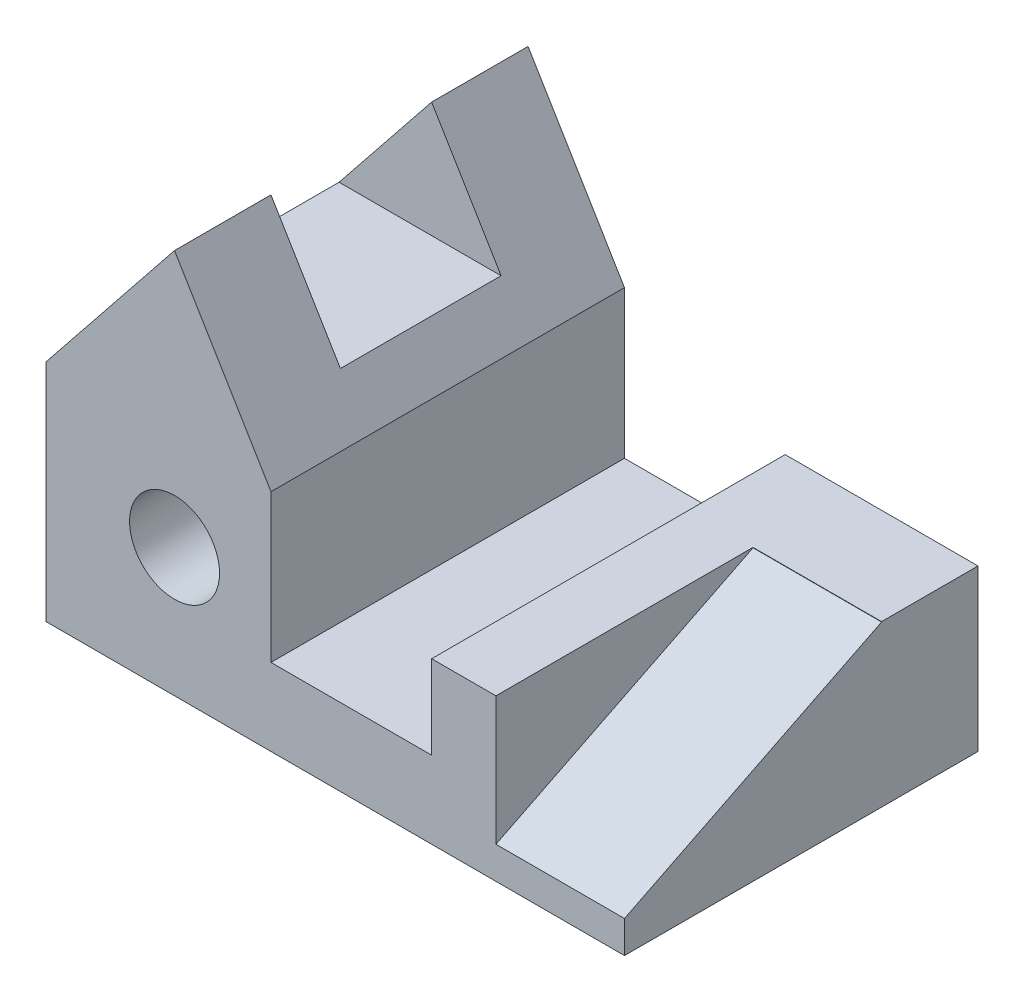
from build123d import *

# Parameters (mm, degrees)
SKETCH1_W             = 90
SKETCH1_H             = 55
BOSS_EXTRUDE1_DEPTH   = 5
SKETCH2_W             = 35
SKETCH2_H             = 55
BOSS_EXTRUDE2_DEPTH   = 30
F_1_0MM_DOWEL_HOLE1_D = 14
SKETCH5_W             = 10
SKETCH5_H             = 55
BOSS_EXTRUDE4_DEPTH   = 20
SKETCH8_W             = 20
SKETCH8_H             = 15
BOSS_EXTRUDE5_DEPTH   = 20
CHAMFER1_SIZE2        = 40
CHAMFER1_SIZE         = 19.943264322
SKETCH9_W             = 25
SKETCH9_H             = 55
BOSS_EXTRUDE6_DEPTH   = 7
BOSS_EXTRUDE7_DEPTH   = 55
SKETCH16_W            = 25
SKETCH16_H            = 18
BOSS_EXTRUDE8_DEPTH   = 43
SKETCH17_W            = 25
SKETCH17_H            = 18
CUT_EXTRUDE1_DEPTH    = 43
F_1_0MM_DOWEL_HOLE2_D = 14


with BuildPart() as part:
    # Sketch1 → Boss-Extrude1 (new body)
    with BuildSketch(Plane(origin=(0, 0, 0), x_dir=(1, 0, 0), z_dir=(0, 1, 0))):
        with Locations((45, -27.5)):
            Rectangle(SKETCH1_W, SKETCH1_H)
    extrude(amount=BOSS_EXTRUDE1_DEPTH)

    # Sketch2 → Boss-Extrude2 (add)
    with BuildSketch(Plane(origin=(0, 5, 0), x_dir=(1, 0, 0), z_dir=(0, 1, 0))):
        with Locations((17.5, -27.5)):
            Rectangle(SKETCH2_W, SKETCH2_H)
    extrude(amount=BOSS_EXTRUDE2_DEPTH)

    # Ø1.0mm Dowel Hole1 (through all)
    with Locations(Plane.XY.offset(55)):
        with Locations((20, 20)):
            Hole(F_1_0MM_DOWEL_HOLE1_D / 2)

    # Sketch5 → Boss-Extrude4 (add)
    with BuildSketch(Plane(origin=(0, 5, 0), x_dir=(1, 0, 0), z_dir=(0, 1, 0))):
        with Locations((65, -27.5)):
            Rectangle(SKETCH5_W, SKETCH5_H)
    extrude(amount=BOSS_EXTRUDE4_DEPTH)

    # Sketch8 → Boss-Extrude5 (add)
    with BuildSketch(Plane(origin=(0, 5, 0), x_dir=(1, 0, 0), z_dir=(0, 1, 0))):
        with Locations((80, -7.5)):
            Rectangle(SKETCH8_W, SKETCH8_H)
    extrude(amount=BOSS_EXTRUDE5_DEPTH)

    # Chamfer1
    chamfer1_edges = [part.edges().sort_by_distance(p)[0] for p in [
        (80, 5, 15),
    ]]
    chamfer1_side = [part.faces().sort_by_distance(p)[0] for p in [
        (80, 5.398865286, 15),
    ]]
    chamfer(chamfer1_edges, length=CHAMFER1_SIZE - 0.0001, length2=CHAMFER1_SIZE2 - 0.0001, reference=chamfer1_side[0])  # a hair under: the kernel refuses the full size

    # Sketch9 → Boss-Extrude6 (add)
    with BuildSketch(Plane(origin=(0, 5, 0), x_dir=(1, 0, 0), z_dir=(0, 1, 0))):
        with Locations((47.5, -27.5)):
            Rectangle(SKETCH9_W, SKETCH9_H)
    extrude(amount=BOSS_EXTRUDE6_DEPTH)

    # Sketch12 → Boss-Extrude7 (add)
    with BuildSketch(Plane.XY.offset(55)):
        Polygon((0, 35), (20, 60), (35, 35), (35, 12), (60, 12), (60, 25), (70, 25), (70, 5), (90, 5), (90, 0), (0, 0), align=None)
    extrude(amount=-BOSS_EXTRUDE7_DEPTH)

    # Sketch16 → Boss-Extrude8 (add)
    with BuildSketch(Plane.ZY):
        with Locations((27.5, 51)):
            Rectangle(SKETCH16_W, SKETCH16_H)
    extrude(amount=-BOSS_EXTRUDE8_DEPTH)

    # Sketch17 → Cut-Extrude1 (cut)
    with BuildSketch(Plane.ZY):
        with Locations((27.5, 51)):
            Rectangle(SKETCH17_W, SKETCH17_H)
    extrude(amount=-CUT_EXTRUDE1_DEPTH, mode=Mode.SUBTRACT)

    # Ø1.0mm Dowel Hole2 (through all)
    with Locations(Plane.XY.offset(55)):
        with Locations((20, 20)):
            Hole(F_1_0MM_DOWEL_HOLE2_D / 2)


solid = part.part
